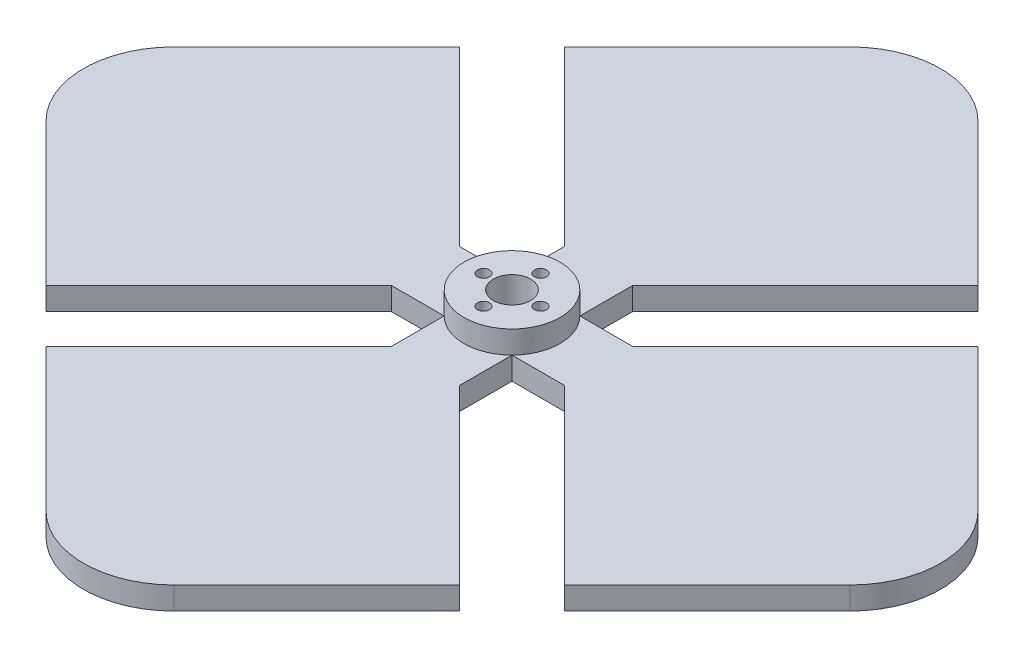
from build123d import *

# Parameters (mm, degrees)
BOSS_EXTRUDE5_DEPTH      = 6.35
FILLET1_R                = 25.4
CIRPATTERN7_COUNT        = 4
FILLET1_OF_CIRPATTERN7_R = 25.4
SKETCH13_R               = 13.470384182
BOSS_EXTRUDE8_DEPTH      = 6.35
SKETCH1_R                = 5.22699996
SKETCH1_R_2              = 1.686500056
CUT_EXTRUDE1_DEPTH       = 171.602385301


with BuildPart() as part:
    # Sketch4 → Boss-Extrude5 (new body)
    with BuildSketch(Plane(origin=(0, 0, 0), x_dir=(1, 0, 0), z_dir=(0, 1, 0))):
        Polygon((24.3205, 9.525), (0, 9.525), (0, -9.525), (24.3205, -9.525), (72.807954542, -58.012454542), (130.820409084, 0), (72.807954542, 58.012454542), align=None)
    boss_extrude5 = extrude(amount=BOSS_EXTRUDE5_DEPTH)

    # Fillet1
    fillet1_edges = [part.edges().sort_by_distance(p)[0] for p in [
        (130.820409084, 3.175, 0),
    ]]
    fillet(fillet1_edges, radius=FILLET1_R)

    # CirPattern7: Boss-Extrude5 ×4 about axis
    cirpattern7_axis = Axis((0, 0, 0), (0, 1, 0))
    for i in range(1, CIRPATTERN7_COUNT):
        add(boss_extrude5.rotate(cirpattern7_axis, i * 360 / CIRPATTERN7_COUNT))

    # Fillet1 of CirPattern7
    fillet1_of_cirpattern7_edges = [part.edges().sort_by_distance(p)[0] for p in [
        (0, 3.175, -130.820409084),
        (-130.820409084, 3.175, 0),
        (0, 3.175, 130.820409084),
    ]]
    fillet(fillet1_of_cirpattern7_edges, radius=FILLET1_OF_CIRPATTERN7_R)

    # Sketch13 → Boss-Extrude8 (add)
    with BuildSketch(Plane(origin=(0, 6.35, 0), x_dir=(1, 0, 0), z_dir=(0, 1, 0))):
        Circle(SKETCH13_R)
    extrude(amount=BOSS_EXTRUDE8_DEPTH)

    # Sketch1 → Cut-Extrude1 (cut, through all)
    with BuildSketch(Plane(origin=(0, 0, 0), x_dir=(1, 0, 0), z_dir=(0, 1, 0))):
        Circle(SKETCH1_R)
        with Locations((8.000000002, 0)):
            Circle(SKETCH1_R_2)
        with Locations((0, -8.000000002)):
            Circle(SKETCH1_R_2)
        with Locations((-8.000000002, 0)):
            Circle(SKETCH1_R_2)
        with Locations((0, 8.000000002)):
            Circle(SKETCH1_R_2)
    extrude(amount=CUT_EXTRUDE1_DEPTH, mode=Mode.SUBTRACT)


solid = part.part
